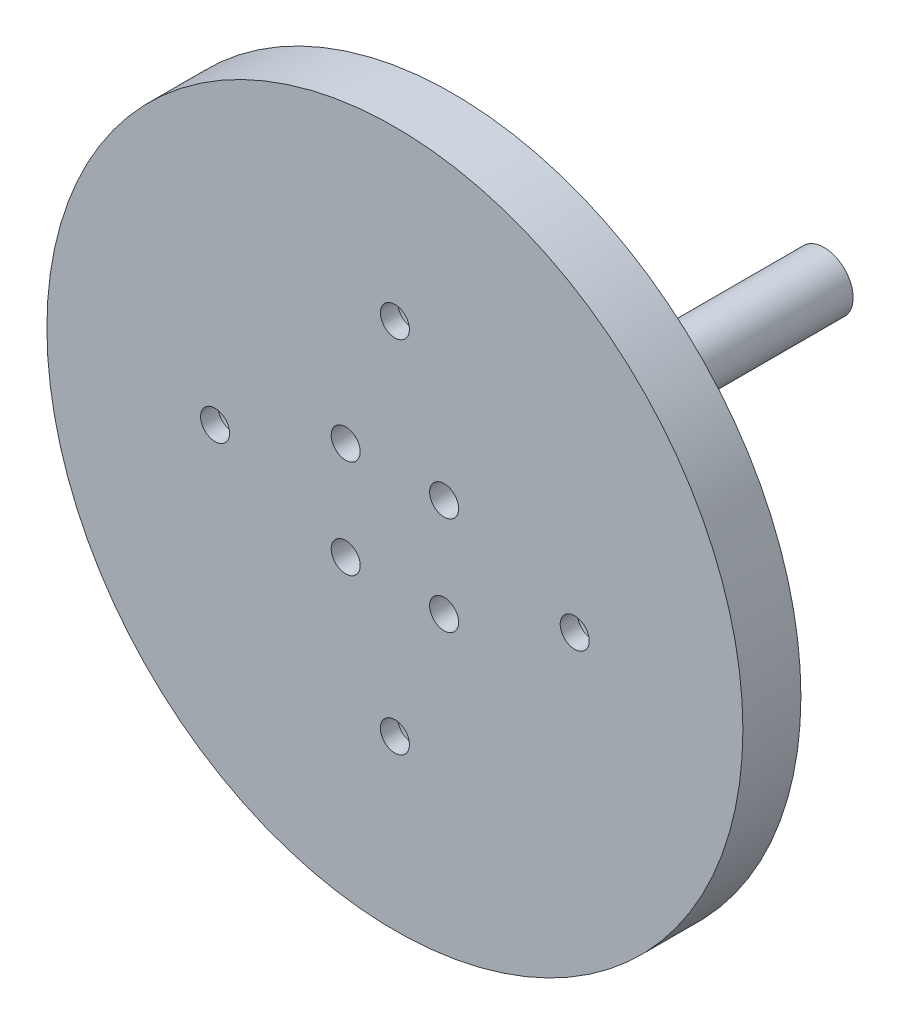
from build123d import *

# Parameters (mm, degrees)
SKETCH1_R           = 30
BOSS_EXTRUDE1_DEPTH = 5
SKETCH2_R           = 1.25
CUT_EXTRUDE1_DEPTH  = 5
SKETCH3_R           = 2.5
BOSS_EXTRUDE2_DEPTH = 32
SKETCH5_R           = 2.75
CUT_EXTRUDE2_DEPTH  = 3.5


with BuildPart() as part:
    # Sketch1 → Boss-Extrude1 (new body)
    with BuildSketch(Plane.XY):
        Circle(SKETCH1_R)
    extrude(amount=BOSS_EXTRUDE1_DEPTH)

    # Sketch2 → Cut-Extrude1 (cut)
    with BuildSketch(Plane.XY.offset(5)):
        with Locations((0, 15.5)):
            Circle(SKETCH2_R)
        with Locations((15.5, 0)):
            Circle(SKETCH2_R)
        with Locations((0, -15.5)):
            Circle(SKETCH2_R)
        with Locations((-15.5, 0)):
            Circle(SKETCH2_R)
        with Locations((4.242640687, 4.242640687)):
            Circle(SKETCH2_R)
        with Locations((4.242640687, -4.242640687)):
            Circle(SKETCH2_R)
        with Locations((-4.242640687, -4.242640687)):
            Circle(SKETCH2_R)
        with Locations((-4.242640687, 4.242640687)):
            Circle(SKETCH2_R)
    extrude(amount=-CUT_EXTRUDE1_DEPTH, mode=Mode.SUBTRACT)

    # Sketch3 → Boss-Extrude2 (add)
    with BuildSketch(Plane(origin=(0, 0, 0), x_dir=(-1, 0, 0), z_dir=(0, 0, -1))):
        Circle(SKETCH3_R)
    extrude(amount=BOSS_EXTRUDE2_DEPTH)

    # Sketch5 → Cut-Extrude2 (cut)
    with BuildSketch(Plane(origin=(0, 0, 0), x_dir=(-1, 0, 0), z_dir=(0, 0, -1))):
        with Locations((15.5, 0)):
            Circle(SKETCH5_R)
        with Locations((0, -15.5)):
            Circle(SKETCH5_R)
        with Locations((-15.5, 0)):
            Circle(SKETCH5_R)
        with Locations((0, 15.5)):
            Circle(SKETCH5_R)
    extrude(amount=-CUT_EXTRUDE2_DEPTH, mode=Mode.SUBTRACT)


solid = part.part
